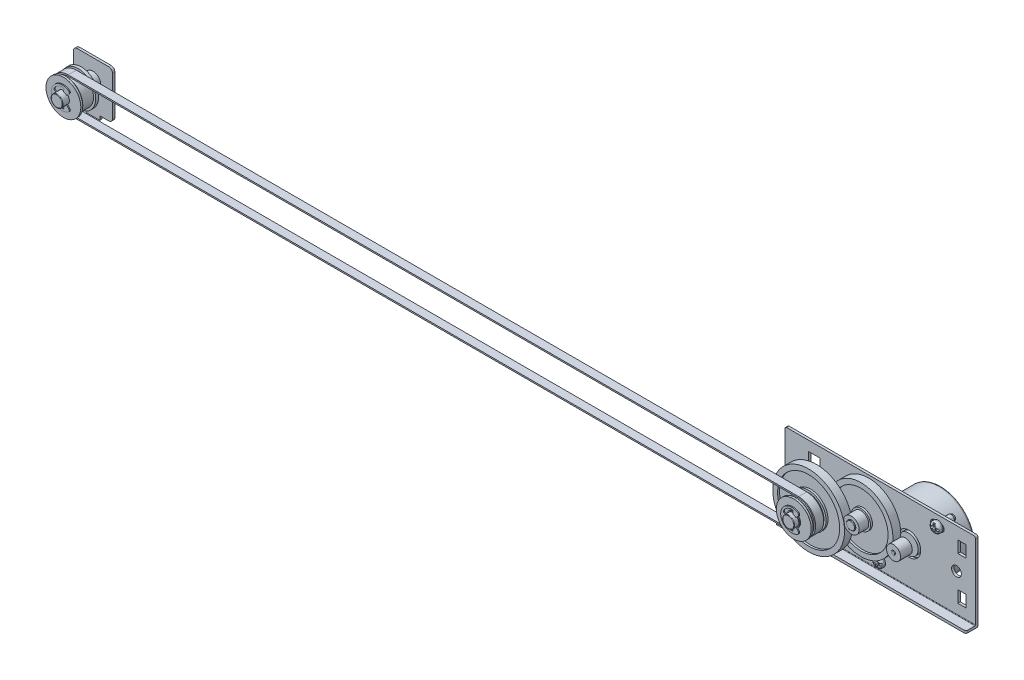
from build123d import *
from OCP.BRepFilletAPI import BRepFilletAPI_MakeChamfer

# Parameters (mm, degrees)
ESBO_O1_W                  = 97.4
ESBO_O1_H                  = 1.25
RESSALTO_EXTRUS_O1_DEPTH   = 6.2
ESBO_O2_W                  = 97.4
ESBO_O2_H                  = 1.25
RESSALTO_EXTRUS_O2_DEPTH   = 40.6
FILETE1_R                  = 1
ESBO_O3_R                  = 2
ESBO_O3_R_2                = 2.5
ESBO_O3_R_3                = 6
ESBO_O3_W                  = 4
ESBO_O3_H                  = 6
ESBO_O3_W_2                = 6
ESBO_O3_H_2                = 8
CORTE_EXTRUS_O1_DEPTH      = 40.6
ESBO_O6_R                  = 3
RESSALTO_EXTRUS_O3_DEPTH   = 22.5
ESBO_O7_R                  = 2.25
RESSALTO_EXTRUS_O4_DEPTH   = 12.3
FILETE2_R                  = 0.25
ESBO_O12_R                 = 4
RESSALTO_EXTRUS_O7_DEPTH   = 3
ESBO_O13_R                 = 4.5
RESSALTO_EXTRUS_O8_DEPTH   = 8.1
ESBO_O8_R                  = 16.365
ESBO_O8_R_2                = 2.3
RESSALTO_EXTRUS_O5_DEPTH   = 4
ESBO_O9_R                  = 4
ESBO_O9_R_2                = 2.3
RESSALTO_EXTRUS_O6_DEPTH   = 8.9
ESBO_O10_R                 = 13.865
ESBO_O10_R_2               = 4.9
CORTE_EXTRUS_O2_DEPTH      = 1
CORTE_EXTRUS_O3_START      = -1
ESBO_O11_R                 = 13.86
ESBO_O11_R_2               = 4.9
CORTE_EXTRUS_O3_DEPTH      = 1
ESBO_O14_R                 = 18.34
ESBO_O14_R_2               = 3.1
RESSALTO_EXTRUS_O9_DEPTH   = 4
ESBO_O15_R                 = 7.8
ESBO_O15_R_2               = 3.1
RESSALTO_EXTRUS_O10_DEPTH  = 11.6
RESSALTO_EXTRUS_O11_START  = -1.5
ESBO_O16_R                 = 8.9
ESBO_O16_R_2               = 3.1
RESSALTO_EXTRUS_O11_DEPTH  = 1.5
CHANFRO1_SIZE              = 0.5
ESBO_O17_R                 = 3.5
ESBO_O17_R_2               = 3.1
RESSALTO_EXTRUS_O12_DEPTH  = 0.5
CORTE_EXTRUS_O4_START      = -1
ESBO_O18_R                 = 15.84
ESBO_O18_R_2               = 8.9
CORTE_EXTRUS_O4_DEPTH      = 1
ESBO_O19_R                 = 15.825
ESBO_O19_R_2               = 8.9
CORTE_EXTRUS_O5_DEPTH      = 1
RESSALTO_EXTRUS_O13_DEPTH  = 0.5
ESBO_O21_R                 = 1.75
RESSALTO_EXTRUS_O14_DEPTH  = 0.92
ESBO_O23_R                 = 17.675026778
RESSALTO_EXTRUS_O15_DEPTH  = 15
FILETE4_R                  = 1
ESBO_O24_R                 = 2.05
ESBO_O24_R_2               = 1.75
RESSALTO_EXTRUS_O16_DEPTH  = 1
ESBO_O25_R                 = 2.5
RESSALTO_EXTRUS_O17_DEPTH  = 0.1
ESBO_O26_R                 = 1
RESSALTO_EXTRUS_O18_DEPTH  = 0.5
FILETE6_R                  = 0.1
ESBO_O27_R                 = 4.99
RESSALTO_EXTRUS_O19_DEPTH  = 16.57
RESSALTO_EXTRUS_O20_START  = -25
ESBO_O28_R                 = 1
RESSALTO_EXTRUS_O20_DEPTH  = 25
FILETE5_R                  = 0.25
ESBO_O29_R                 = 3.59
RESSALTO_EXTRUS_O21_DEPTH  = 6
ESBO_O30_R                 = 2.7
RESSALTO_EXTRUS_O22_DEPTH  = 2
FILETE7_R                  = 1.4
CORTE_EXTRUS_O6_DEPTH      = 1.4
ESBO_O32_R                 = 1.75
RESSALTO_EXTRUS_O23_DEPTH  = 7.8
CHANFRO2_SIZE              = 1
CHANFRO2_SIZE2             = 0.466307658
RESSALTO_EXTRUS_O24_DEPTH  = 10
ESBO_O34_R                 = 2
RESSALTO_EXTRUS_O25_DEPTH  = 5
ESBO_O35_R                 = 7.8
RESSALTO_EXTRUS_O26_DEPTH  = 7.6
ESBO_O37_R                 = 8.9
RESSALTO_EXTRUS_O27_DEPTH  = 1.5
CHANFRO3_SIZE              = 0.5
ESBO_O38_R                 = 8.9
RESSALTO_EXTRUS_O28_DEPTH  = 1.5
CORTE_EXTRUS_O7_DEPTH      = 16
CORTE_EXTRUS_O7_DEPTH_BACK = 35.5
ESBO_O39_R                 = 3.05
ESBO_O40_R                 = 4
RESSALTO_EXTRUS_O29_DEPTH  = 6
ESBO_O41_R                 = 3
RESSALTO_EXTRUS_O30_DEPTH  = 18.5
FILETE8_R                  = 0.25
RESSALTO_EXTRUS_O31_DEPTH  = 0.5
RESSALTO_EXTRUS_O32_DEPTH  = 1.2
FILETE9_R                  = 2
FILETE10_R                 = 0.3
RESSALTO_EXTRUS_O33_DEPTH  = 4.15
FILETE11_R                 = 0.5
FILETE12_R                 = 0.25


with BuildPart() as part:
    # Esboço1 → Ressalto-extrusão1 (new body)
    with BuildSketch(Plane.XY):
        Rectangle(ESBO_O1_W, ESBO_O1_H)
    extrude(amount=RESSALTO_EXTRUS_O1_DEPTH)

    # Esboço2 → Ressalto-extrusão2 (add)
    with BuildSketch(Plane(origin=(0, -0.625, 0), x_dir=(1, 0, 0), z_dir=(0, 1, 0))):
        with Locations((0, -0.625)):
            Rectangle(ESBO_O2_W, ESBO_O2_H)
    extrude(amount=RESSALTO_EXTRUS_O2_DEPTH)

    # Filete1
    filete1_edges = [part.edges().sort_by_distance(p)[0] for p in [
        (48.7, 0, 6.2),
        (48.7, 39.975, 0.625),
        (-48.7, 39.975, 0.625),
        (-48.7, 0, 6.2),
    ]]
    fillet(filete1_edges, radius=FILETE1_R)

    # Esboço3 → Corte-extrusão1 (cut)
    with BuildSketch(Plane.XY.offset(1.25)):
        with Locations((-43.7, 4.975)):
            Circle(ESBO_O3_R)
        with Locations((0, 4.975)):
            Circle(ESBO_O3_R)
        with Locations((38.95, 19.8)):
            Circle(ESBO_O3_R_2)
        with Locations((14.7, 19.8)):
            Circle(ESBO_O3_R_3)
        with Locations((41.7, 30.975)):
            Rectangle(ESBO_O3_W, ESBO_O3_H)
        with Locations((41.7, 8.975)):
            Rectangle(ESBO_O3_W, ESBO_O3_H)
        with Locations((-33.7, 8.975)):
            Rectangle(ESBO_O3_W_2, ESBO_O3_H_2)
        with BuildLine():
            Line((27.7, 36.975), (30.7, 36.975))
            ThreePointArc((30.7, 36.975), (32.7, 34.975), (30.7, 32.975))
            Line((30.7, 32.975), (27.7, 32.975))
            ThreePointArc((27.7, 32.975), (25.7, 34.975), (27.7, 36.975))
        make_face()
        with Locations((-33.7, 30.975)):
            Rectangle(ESBO_O3_W_2, ESBO_O3_H_2)
    extrude(amount=-CORTE_EXTRUS_O1_DEPTH, mode=Mode.SUBTRACT)

    # Esboço6 → Ressalto-extrusão3 (add)
    with BuildSketch(Plane(origin=(0, 0, 0), x_dir=(-1, 0, 0), z_dir=(0, 0, -1))):
        with Locations((25.7, 19.8)):
            Circle(ESBO_O6_R)
    extrude(amount=-RESSALTO_EXTRUS_O3_DEPTH)

    # Esboço7 → Ressalto-extrusão4 (add)
    with BuildSketch(Plane(origin=(0, 0, 0), x_dir=(-1, 0, 0), z_dir=(0, 0, -1))):
        with Locations((4.1, 23.975)):
            Circle(ESBO_O7_R)
    extrude(amount=-RESSALTO_EXTRUS_O4_DEPTH)

    # Filete2
    filete2_edges = [part.edges().sort_by_distance(p)[0] for p in [
        (-22.7, 19.8, 22.5),
        (-1.85, 23.975, 12.3),
    ]]
    fillet(filete2_edges, radius=FILETE2_R)

    # Esboço12 → Ressalto-extrusão7 (add)
    with BuildSketch(Plane.XY):
        with Locations(Location((-4.1, 23.975, 0), (0, 0, 180))):
            Circle(ESBO_O12_R)
    extrude(amount=RESSALTO_EXTRUS_O7_DEPTH)

    # Esboço13 → Ressalto-extrusão8 (add)
    with BuildSketch(Plane(origin=(0, 0, 0), x_dir=(-1, 0, 0), z_dir=(0, 0, -1))):
        with Locations((25.7, 19.8)):
            Circle(ESBO_O13_R)
    extrude(amount=-RESSALTO_EXTRUS_O8_DEPTH)

    # Esboço8 → Ressalto-extrusão5 (add)
    with BuildSketch(Plane.XY.offset(3)):
        with Locations((-4.1, 23.975)):
            Circle(ESBO_O8_R)
        with Locations((-4.1, 23.975)):
            Circle(ESBO_O8_R_2, mode=Mode.SUBTRACT)
    extrude(amount=RESSALTO_EXTRUS_O5_DEPTH)

    # Esboço9 → Ressalto-extrusão6 (add)
    with BuildSketch(Plane.XY.offset(3)):
        with Locations(Location((-4.1, 23.975, 0), (0, 0, 180))):
            Circle(ESBO_O9_R)
        with Locations((-4.1, 23.975)):
            Circle(ESBO_O9_R_2, mode=Mode.SUBTRACT)
    extrude(amount=RESSALTO_EXTRUS_O6_DEPTH)

    # Esboço10 → Corte-extrusão2 (cut)
    with BuildSketch(Plane.XY.offset(7)):
        with Locations((-4.1, 23.975)):
            Circle(ESBO_O10_R)
        with Locations((-4.1, 23.975)):
            Circle(ESBO_O10_R_2, mode=Mode.SUBTRACT)
    extrude(amount=-CORTE_EXTRUS_O2_DEPTH, mode=Mode.SUBTRACT)

    # Esboço11 → Corte-extrusão3 (cut)
    with BuildSketch(Plane(origin=(0, 0, 3), x_dir=(-1, 0, 0), z_dir=(0, 0, -1)).offset(CORTE_EXTRUS_O3_START)):
        with Locations((4.1, 23.975)):
            Circle(ESBO_O11_R)
        with Locations(Location((4.1, 23.975, 0), (0, 0, 180))):
            Circle(ESBO_O11_R_2, mode=Mode.SUBTRACT)
    extrude(amount=CORTE_EXTRUS_O3_DEPTH, mode=Mode.SUBTRACT)

    # Esboço14 → Ressalto-extrusão9 (add)
    with BuildSketch(Plane.XY.offset(8.1)):
        with Locations(Location((-25.7, 19.8, 0), (0, 0, 15.545528491))):
            Circle(ESBO_O14_R)
        with Locations((-25.7, 19.8)):
            Circle(ESBO_O14_R_2, mode=Mode.SUBTRACT)
    extrude(amount=RESSALTO_EXTRUS_O9_DEPTH)

    # Esboço15 → Ressalto-extrusão10 (add)
    with BuildSketch(Plane.XY.offset(8.1)):
        with Locations((-25.7, 19.8)):
            Circle(ESBO_O15_R)
        with Locations((-25.7, 19.8)):
            Circle(ESBO_O15_R_2, mode=Mode.SUBTRACT)
    extrude(amount=RESSALTO_EXTRUS_O10_DEPTH)

    # Esboço16 → Ressalto-extrusão11 (add)
    with BuildSketch(Plane.XY.offset(19.7).offset(RESSALTO_EXTRUS_O11_START)):
        with Locations((-25.7, 19.8)):
            Circle(ESBO_O16_R)
        with Locations((-25.7, 19.8)):
            Circle(ESBO_O16_R_2, mode=Mode.SUBTRACT)
    extrude(amount=RESSALTO_EXTRUS_O11_DEPTH)

    # Chanfro1
    chanfro1_edges = [part.edges().sort_by_distance(p)[0] for p in [
        (-34.6, 19.8, 18.2),
    ]]
    chamfer(chanfro1_edges, length=CHANFRO1_SIZE)

    # Esboço17 → Ressalto-extrusão12 (add)
    with BuildSketch(Plane.XY.offset(19.7)):
        with Locations((-25.7, 19.8)):
            Circle(ESBO_O17_R)
        with Locations((-25.7, 19.8)):
            Circle(ESBO_O17_R_2, mode=Mode.SUBTRACT)
    extrude(amount=RESSALTO_EXTRUS_O12_DEPTH)

    # Esboço18 → Corte-extrusão4 (cut)
    with BuildSketch(Plane.XY.offset(12.1).offset(CORTE_EXTRUS_O4_START)):
        with Locations((-25.7, 19.8)):
            Circle(ESBO_O18_R)
        with Locations((-25.7, 19.8)):
            Circle(ESBO_O18_R_2, mode=Mode.SUBTRACT)
    extrude(amount=CORTE_EXTRUS_O4_DEPTH, mode=Mode.SUBTRACT)

    # Esboço19 → Corte-extrusão5 (cut)
    with BuildSketch(Plane(origin=(0, 0, 8.1), x_dir=(-1, 0, 0), z_dir=(0, 0, -1))):
        with Locations((25.7, 19.8)):
            Circle(ESBO_O19_R)
        with Locations(Location((25.7, 19.8, 0), (0, 0, 180))):
            Circle(ESBO_O19_R_2, mode=Mode.SUBTRACT)
    extrude(amount=-CORTE_EXTRUS_O5_DEPTH, mode=Mode.SUBTRACT)

    # Esboço20 → Ressalto-extrusão13 (add)
    with BuildSketch(Plane.XY.offset(20.2)):
        with BuildLine():
            Line((-28.322721615, 20.626940949), (-29.67498238, 21.05330713))
            ThreePointArc((-29.67498238, 21.05330713), (-29.981119219, 21.326162864), (-29.980184512, 21.736247175))
            ThreePointArc((-29.980184512, 21.736247175), (-28.137076875, 23.816178393), (-25.441102958, 24.490629478))
            ThreePointArc((-25.441102958, 24.490629478), (-25.076922131, 24.302102712), (-24.9762544, 23.904565262))
            Line((-24.9762544, 23.904565262), (-25.222467511, 22.508221321))
            ThreePointArc((-25.222467511, 22.508221321), (-24.430191314, 22.239279791), (-23.755456352, 21.744543648))
            Line((-23.755456352, 21.744543648), (-22.474650348, 23.025349652))
            ThreePointArc((-22.474650348, 23.025349652), (-22.187573749, 23.840156974), (-22.642480013, 24.574584803))
            ThreePointArc((-22.642480013, 24.574584803), (-31.36966388, 19.8), (-22.642480013, 15.025415197))
            ThreePointArc((-22.642480013, 15.025415197), (-22.187573749, 15.759843026), (-22.474650348, 16.574650348))
            Line((-22.474650348, 16.574650348), (-23.755456352, 17.855456352))
            ThreePointArc((-23.755456352, 17.855456352), (-24.430191314, 17.360720209), (-25.222467511, 17.091778679))
            Line((-25.222467511, 17.091778679), (-24.9762544, 15.695434738))
            ThreePointArc((-24.9762544, 15.695434738), (-25.076922131, 15.297897288), (-25.441102958, 15.109370522))
            ThreePointArc((-25.441102958, 15.109370522), (-28.137076875, 15.783821607), (-29.980184512, 17.863752825))
            ThreePointArc((-29.980184512, 17.863752825), (-29.981119219, 18.273837136), (-29.67498238, 18.54669287))
            Line((-29.67498238, 18.54669287), (-28.322721615, 18.973059051))
            ThreePointArc((-28.322721615, 18.973059051), (-28.45, 19.8), (-28.322721615, 20.626940949))
        make_face()
    extrude(amount=RESSALTO_EXTRUS_O13_DEPTH)

    # Esboço21 → Ressalto-extrusão14 (add)
    with BuildSketch(Plane(origin=(0, 0, 0), x_dir=(-1, 0, 0), z_dir=(0, 0, -1))):
        with BuildLine():
            Line((3.595164465, 5.161527392), (2.779555471, 20.88173038))
            ThreePointArc((2.779555471, 20.88173038), (-2.196938457, 32.222448714), (-13.433733778, 37.429349428))
            Line((-13.433733778, 37.429349428), (-29.134017665, 38.565609025))
            ThreePointArc((-29.134017665, 38.565609025), (-31.845866586, 37.610857858), (-32.993876913, 34.975))
            Line((-32.993876913, 34.975), (-32.993876913, 30.076020514))
            Line((-32.993876913, 30.076020514), (-30.487753652, 27.518219171))
            ThreePointArc((-30.487753652, 27.518219171), (-27.196938457, 7.727551286), (-7.477551833, 4.033530282))
            Line((-7.477551833, 4.033530282), (-4.87273477, 1.375))
            Line((-4.87273477, 1.375), (0, 1.375))
            ThreePointArc((0, 1.375), (2.610699007, 2.49624009), (3.595164465, 5.161527392))
        make_face()
        with Locations((0, 4.975)):
            Circle(ESBO_O21_R, mode=Mode.SUBTRACT)
        with Locations((-29.393876913, 34.975)):
            Circle(ESBO_O21_R, mode=Mode.SUBTRACT)
    extrude(amount=RESSALTO_EXTRUS_O14_DEPTH)

    # Esboço23 → Ressalto-extrusão15 (add)
    with BuildSketch(Plane.XY):
        with Locations((14.7, 19.8)):
            Circle(ESBO_O23_R)
    extrude(amount=-RESSALTO_EXTRUS_O15_DEPTH)

    # Filete4
    filete4_edges = [part.edges().sort_by_distance(p)[0] for p in [
        (-2.975026778, 19.8, -15),
    ]]
    fillet(filete4_edges, radius=FILETE4_R)

    # Esboço24 → Ressalto-extrusão16 (add)
    # profile 1 of 2: a face of its own
    with BuildSketch(Plane(origin=(0, 0, -0.92), x_dir=(-1, 0, 0), z_dir=(0, 0, -1))):
        with Locations((0, 4.975)):
            Circle(ESBO_O24_R)
        with Locations((0, 4.975)):
            Circle(ESBO_O24_R_2, mode=Mode.SUBTRACT)
    # profile 2 of 2: a face of its own
    with BuildSketch(Plane(origin=(0, 0, -0.92), x_dir=(-1, 0, 0), z_dir=(0, 0, -1))):
        with Locations((-29.393876913, 34.975)):
            Circle(ESBO_O24_R)
        with Locations((-29.393876913, 34.975)):
            Circle(ESBO_O24_R_2, mode=Mode.SUBTRACT)
    extrude(amount=RESSALTO_EXTRUS_O16_DEPTH)

    # Esboço25 → Ressalto-extrusão17 (add)
    with BuildSketch(Plane(origin=(0, 0, -15), x_dir=(-1, 0, 0), z_dir=(0, 0, -1))):
        with Locations(Location((-14.7, 19.8, 0), (0, 0, 180))):
            Circle(ESBO_O25_R)
    extrude(amount=RESSALTO_EXTRUS_O17_DEPTH)

    # Esboço26 → Ressalto-extrusão18 (add)
    with BuildSketch(Plane(origin=(0, 0, -15.1), x_dir=(-1, 0, 0), z_dir=(0, 0, -1))):
        with Locations((-14.7, 19.8)):
            Circle(ESBO_O26_R)
    extrude(amount=RESSALTO_EXTRUS_O18_DEPTH)

    # Filete6
    filete6_edges = [part.edges().sort_by_distance(p)[0] for p in [
        (12.2, 19.8, -15.1),
    ]]
    fillet(filete6_edges, radius=FILETE6_R - 0.0001)  # a hair under: the kernel refuses the full size

    # Esboço27 → Ressalto-extrusão19 (add)
    with BuildSketch(Plane.XY.offset(-15)):
        with Locations(Location((14.7, 19.8, 0), (0, 0, 180))):
            Circle(ESBO_O27_R)
    extrude(amount=RESSALTO_EXTRUS_O19_DEPTH)

    # Esboço28 → Ressalto-extrusão20 (add)
    with BuildSketch(Plane(origin=(0, 0, -15.6), x_dir=(-1, 0, 0), z_dir=(0, 0, -1)).offset(RESSALTO_EXTRUS_O20_START)):
        with Locations((-14.7, 19.8)):
            Circle(ESBO_O28_R)
    extrude(amount=RESSALTO_EXTRUS_O20_DEPTH)

    # Filete5
    filete5_edges = [part.edges().sort_by_distance(p)[0] for p in [
        (15.7, 19.8, -15.6),
        (15.7, 19.8, 9.4),
    ]]
    fillet(filete5_edges, radius=FILETE5_R)

    # Esboço29 → Ressalto-extrusão21 (add)
    with BuildSketch(Plane.XY.offset(9.15)):
        with Locations((14.7, 19.8)):
            Circle(ESBO_O29_R)
    extrude(amount=-RESSALTO_EXTRUS_O21_DEPTH)

    # Esboço30 → Ressalto-extrusão22 (add)
    with BuildSketch(Plane.XY.offset(1.25)):
        with Locations(Location((0, 4.975, 0), (0, 0, 180))):
            Circle(ESBO_O30_R)
        with Locations(Location((29.393876913, 34.975, 0), (0, 0, 227.672748848))):
            Circle(ESBO_O30_R)
    extrude(amount=RESSALTO_EXTRUS_O22_DEPTH)

    # Filete7
    filete7_edges = [part.edges().sort_by_distance(p)[0] for p in [
        (2.7, 4.975, 3.25),
        (31.211960314, 36.971139461, 3.25),
    ]]
    fillet(filete7_edges, radius=FILETE7_R)

    # Esboço31 → Corte-extrusão6 (cut)
    with BuildSketch(Plane.XY.offset(3.25)):
        with BuildLine():
            Line((29.093876913, 37.175), (29.693876913, 37.175))
            ThreePointArc((29.693876913, 37.175), (29.83529827, 37.116421356), (29.893876913, 36.975))
            Line((29.893876913, 36.975), (29.893876913, 35.975))
            ThreePointArc((29.893876913, 35.975), (30.040323523, 35.621446609), (30.393876913, 35.475))
            Line((30.393876913, 35.475), (31.393876913, 35.475))
            ThreePointArc((31.393876913, 35.475), (31.53529827, 35.416421356), (31.593876913, 35.275))
            Line((31.593876913, 35.275), (31.593876913, 34.675))
            ThreePointArc((31.593876913, 34.675), (31.53529827, 34.533578644), (31.393876913, 34.475))
            Line((31.393876913, 34.475), (30.393876913, 34.475))
            ThreePointArc((30.393876913, 34.475), (30.040323523, 34.328553391), (29.893876913, 33.975))
            Line((29.893876913, 33.975), (29.893876913, 32.975))
            ThreePointArc((29.893876913, 32.975), (29.83529827, 32.833578644), (29.693876913, 32.775))
            Line((29.693876913, 32.775), (29.093876913, 32.775))
            ThreePointArc((29.093876913, 32.775), (28.952455557, 32.833578644), (28.893876913, 32.975))
            Line((28.893876913, 32.975), (28.893876913, 33.975))
            ThreePointArc((28.893876913, 33.975), (28.747430304, 34.328553391), (28.393876913, 34.475))
            Line((28.393876913, 34.475), (27.393876913, 34.475))
            ThreePointArc((27.393876913, 34.475), (27.252455557, 34.533578644), (27.193876913, 34.675))
            Line((27.193876913, 34.675), (27.193876913, 35.275))
            ThreePointArc((27.193876913, 35.275), (27.252455557, 35.416421356), (27.393876913, 35.475))
            Line((27.393876913, 35.475), (28.393876913, 35.475))
            ThreePointArc((28.393876913, 35.475), (28.747430304, 35.621446609), (28.893876913, 35.975))
            Line((28.893876913, 35.975), (28.893876913, 36.975))
            ThreePointArc((28.893876913, 36.975), (28.952455557, 37.116421356), (29.093876913, 37.175))
        make_face()
        with BuildLine():
            Line((-0.142061447, 7.325028719), (0.457938553, 7.325028719))
            ThreePointArc((0.457938553, 7.325028719), (0.59935991, 7.266450075), (0.657938553, 7.125028719))
            Line((0.657938553, 7.125028719), (0.657938553, 6.125028719))
            ThreePointArc((0.657938553, 6.125028719), (0.804385163, 5.771475328), (1.157938553, 5.625028719))
            Line((1.157938553, 5.625028719), (2.157938553, 5.625028719))
            ThreePointArc((2.157938553, 5.625028719), (2.29935991, 5.566450075), (2.357938553, 5.425028719))
            Line((2.357938553, 5.425028719), (2.357938553, 4.825028719))
            ThreePointArc((2.357938553, 4.825028719), (2.29935991, 4.683607363), (2.157938553, 4.625028719))
            Line((2.157938553, 4.625028719), (1.157938553, 4.625028719))
            ThreePointArc((1.157938553, 4.625028719), (0.804385163, 4.478582109), (0.657938553, 4.125028719))
            Line((0.657938553, 4.125028719), (0.657938553, 3.125028719))
            ThreePointArc((0.657938553, 3.125028719), (0.59935991, 2.983607363), (0.457938553, 2.925028719))
            Line((0.457938553, 2.925028719), (-0.142061447, 2.925028719))
            ThreePointArc((-0.142061447, 2.925028719), (-0.283482803, 2.983607363), (-0.342061447, 3.125028719))
            Line((-0.342061447, 3.125028719), (-0.342061447, 4.125028719))
            ThreePointArc((-0.342061447, 4.125028719), (-0.488508056, 4.478582109), (-0.842061447, 4.625028719))
            Line((-0.842061447, 4.625028719), (-1.842061447, 4.625028719))
            ThreePointArc((-1.842061447, 4.625028719), (-1.983482803, 4.683607363), (-2.042061447, 4.825028719))
            Line((-2.042061447, 4.825028719), (-2.042061447, 5.425028719))
            ThreePointArc((-2.042061447, 5.425028719), (-1.983482803, 5.566450075), (-1.842061447, 5.625028719))
            Line((-1.842061447, 5.625028719), (-0.842061447, 5.625028719))
            ThreePointArc((-0.842061447, 5.625028719), (-0.488508056, 5.771475328), (-0.342061447, 6.125028719))
            Line((-0.342061447, 6.125028719), (-0.342061447, 7.125028719))
            ThreePointArc((-0.342061447, 7.125028719), (-0.283482803, 7.266450075), (-0.142061447, 7.325028719))
        make_face()
    extrude(amount=-CORTE_EXTRUS_O6_DEPTH, mode=Mode.SUBTRACT)

    # Esboço32 → Ressalto-extrusão23 (add)
    with BuildSketch(Plane(origin=(0, 0, 1.25), x_dir=(-1, 0, 0), z_dir=(0, 0, -1))):
        with Locations((0, 4.975)):
            Circle(ESBO_O32_R)
        with Locations(Location((-29.393876913, 34.975, 0), (0, 0, 180))):
            Circle(ESBO_O32_R)
    extrude(amount=RESSALTO_EXTRUS_O23_DEPTH)

    # Chanfro2: one chamfer whose edges measure the first distance from different faces: ONE call of the kernel's chamfer builder (chamfer() names one face for all edges)
    chanfro2_edges_1 = [part.edges().sort_by_distance(p)[0] for p in [
        (1.75, 4.975, -6.55),
    ]]
    chanfro2_side_1 = [part.faces().sort_by_distance(p)[0] for p in [
        (1.75, 4.975, -4.235),
    ]]
    chanfro2_edges_2 = [part.edges().sort_by_distance(p)[0] for p in [
        (27.643876913, 34.975, -6.55),
    ]]
    chanfro2_side_2 = [part.faces().sort_by_distance(p)[0] for p in [
        (27.643876913, 34.975, -4.235),
    ]]
    chanfro2 = BRepFilletAPI_MakeChamfer(part.part.solid().wrapped)
    for e in chanfro2_edges_1:
        chanfro2.Add(CHANFRO2_SIZE, CHANFRO2_SIZE2, e.wrapped, chanfro2_side_1[0].wrapped)  # the first distance lies on this face
    for e in chanfro2_edges_2:
        chanfro2.Add(CHANFRO2_SIZE, CHANFRO2_SIZE2, e.wrapped, chanfro2_side_2[0].wrapped)  # the first distance lies on this face
    add(Compound.cast(chanfro2.Shape()), mode=Mode.REPLACE)

    # Esboço33 → Ressalto-extrusão24 (add)
    with BuildSketch(Plane(origin=(0, 0, -0.92), x_dir=(-1, 0, 0), z_dir=(0, 0, -1))):
        with BuildLine():
            Line((3.196311276, 12.849099671), (3.224269109, 12.846096875))
            Line((3.224269109, 12.846096875), (4.292171901, 22.788912554))
            Line((4.292171901, 22.788912554), (2.690076099, 22.960984796))
            ThreePointArc((2.690076099, 22.960984796), (2.95476648, 20.646044994), (2.912651997, 18.316402606))
            Line((2.912651997, 18.316402606), (3.196311276, 12.849099671))
        make_face()
        with BuildLine():
            Line((1.622173307, 13.018169117), (3.196311276, 12.849099671))
            Line((3.196311276, 12.849099671), (2.912651997, 18.316402606))
            ThreePointArc((2.912651997, 18.316402606), (2.472970379, 15.617218633), (1.622173307, 13.018169117))
        make_face()
    extrude(amount=RESSALTO_EXTRUS_O24_DEPTH)

    # Esboço34 → Ressalto-extrusão25 (add)
    with BuildSketch(Plane(origin=(-1.823505509, -0.195852632, 0), x_dir=(0, 0, 1), z_dir=(-0.9942815679049348, -0.10679027916671441, 0))):
        with Locations(Location((-5.92, 18.116957941, 0), (0, 0, 270))):
            Circle(ESBO_O34_R)
    extrude(amount=RESSALTO_EXTRUS_O25_DEPTH)

    # Filete11
    filete11_edges = [part.edges().sort_by_distance(p)[0] for p in [
        (0, -0.625, 0),
    ]]
    fillet(filete11_edges, radius=FILETE11_R)

    # Filete12
    filete12_edges = [part.edges().sort_by_distance(p)[0] for p in [
        (0, 0.625, 1.25),
    ]]
    fillet(filete12_edges, radius=FILETE12_R)


with BuildPart() as body_2:
    # Esboço35 → Ressalto-extrusão26 (new body)
    with BuildSketch(Plane.XY.offset(12.1)):
        with Locations(Location((-398.7, 19.8, 0), (0, 0, 180))):
            Circle(ESBO_O35_R)
    extrude(amount=RESSALTO_EXTRUS_O26_DEPTH)

    # Esboço37 → Ressalto-extrusão27 (add)
    with BuildSketch(Plane.XY.offset(19.7)):
        with Locations((-398.7, 19.8)):
            Circle(ESBO_O37_R)
    extrude(amount=-RESSALTO_EXTRUS_O27_DEPTH)

    # Chanfro3
    chanfro3_edges = [body_2.edges().sort_by_distance(p)[0] for p in [
        (-407.6, 19.8, 18.2),
    ]]
    chamfer(chanfro3_edges, length=CHANFRO3_SIZE)

    # Esboço38 → Ressalto-extrusão28 (add)
    with BuildSketch(Plane(origin=(0, 0, 12.1), x_dir=(-1, 0, 0), z_dir=(0, 0, -1))):
        with Locations(Location((398.7, 19.8, 0), (0, 0, 180))):
            Circle(ESBO_O38_R)
    extrude(amount=RESSALTO_EXTRUS_O28_DEPTH)

    # Esboço39 → Corte-extrusão7 (cut, two sides: drawn at the far end of the back side and taken through both)
    with BuildSketch(Plane.XY.offset(19.7).offset(-CORTE_EXTRUS_O7_DEPTH_BACK)):
        with Locations(Location((-398.7, 19.8, 0), (0, 0, 180))):
            Circle(ESBO_O39_R)
    extrude(amount=CORTE_EXTRUS_O7_DEPTH + CORTE_EXTRUS_O7_DEPTH_BACK, mode=Mode.SUBTRACT)

    # Esboço40 → Ressalto-extrusão29 (add)
    with BuildSketch(Plane(origin=(0, 0, 10.6), x_dir=(-1, 0, 0), z_dir=(0, 0, -1))):
        with Locations((398.7, 19.8)):
            Circle(ESBO_O40_R)
    extrude(amount=RESSALTO_EXTRUS_O29_DEPTH)

    # Esboço41 → Ressalto-extrusão30 (add)
    with BuildSketch(Plane(origin=(0, 0, 4.6), x_dir=(-1, 0, 0), z_dir=(0, 0, -1))):
        with Locations((398.7, 19.8)):
            Circle(ESBO_O41_R)
    extrude(amount=-RESSALTO_EXTRUS_O30_DEPTH)

    # Filete8
    filete8_edges = [body_2.edges().sort_by_distance(p)[0] for p in [
        (-395.7, 19.8, 23.1),
    ]]
    fillet(filete8_edges, radius=FILETE8_R)

    # Esboço42 → Ressalto-extrusão31 (add)
    with BuildSketch(Plane.XY.offset(19.7)):
        with BuildLine():
            Line((-401.322721615, 20.626940949), (-402.67498238, 21.05330713))
            ThreePointArc((-402.67498238, 21.05330713), (-402.981119219, 21.326162864), (-402.980184512, 21.736247175))
            ThreePointArc((-402.980184512, 21.736247175), (-401.137076875, 23.816178393), (-398.441102958, 24.490629478))
            ThreePointArc((-398.441102958, 24.490629478), (-398.076922131, 24.302102712), (-397.9762544, 23.904565262))
            Line((-397.9762544, 23.904565262), (-398.222467511, 22.508221321))
            ThreePointArc((-398.222467511, 22.508221321), (-397.430191314, 22.239279791), (-396.755456352, 21.744543648))
            Line((-396.755456352, 21.744543648), (-395.474650348, 23.025349652))
            ThreePointArc((-395.474650348, 23.025349652), (-395.187573749, 23.840156974), (-395.642480013, 24.574584803))
            ThreePointArc((-395.642480013, 24.574584803), (-404.36966388, 19.8), (-395.642480013, 15.025415197))
            ThreePointArc((-395.642480013, 15.025415197), (-395.187573749, 15.759843026), (-395.474650348, 16.574650348))
            Line((-395.474650348, 16.574650348), (-396.755456352, 17.855456352))
            ThreePointArc((-396.755456352, 17.855456352), (-397.430191314, 17.360720209), (-398.222467511, 17.091778679))
            Line((-398.222467511, 17.091778679), (-397.9762544, 15.695434738))
            ThreePointArc((-397.9762544, 15.695434738), (-398.076922131, 15.297897288), (-398.441102958, 15.109370522))
            ThreePointArc((-398.441102958, 15.109370522), (-401.137076875, 15.783821607), (-402.980184512, 17.863752825))
            ThreePointArc((-402.980184512, 17.863752825), (-402.981119219, 18.273837136), (-402.67498238, 18.54669287))
            Line((-402.67498238, 18.54669287), (-401.322721615, 18.973059051))
            ThreePointArc((-401.322721615, 18.973059051), (-401.45, 19.8), (-401.322721615, 20.626940949))
        make_face()
    extrude(amount=RESSALTO_EXTRUS_O31_DEPTH)

    # Esboço43 → Ressalto-extrusão32 (add)
    with BuildSketch(Plane(origin=(0, 0, 4.6), x_dir=(-1, 0, 0), z_dir=(0, 0, -1))):
        Polygon((402.2, 5.8), (402.2, 3.8), (395.2, 3.8), (395.2, 5.8), (388.7, 5.8), (388.7, 29.8), (408.7, 29.8), (408.7, 5.8), align=None)
    extrude(amount=RESSALTO_EXTRUS_O32_DEPTH)

    # Filete9
    filete9_edges = [body_2.edges().sort_by_distance(p)[0] for p in [
        (-408.7, 5.8, 4),
        (-408.7, 29.8, 4),
        (-388.7, 29.8, 4),
        (-388.7, 5.8, 4),
    ]]
    fillet(filete9_edges, radius=FILETE9_R)

    # Filete10
    filete10_edges = [body_2.edges().sort_by_distance(p)[0] for p in [
        (-395.2, 5.8, 4),
        (-402.2, 5.8, 4),
    ]]
    fillet(filete10_edges, radius=FILETE10_R)


with BuildPart() as body_3:
    # Esboço44 → Ressalto-extrusão33 (new body)
    with BuildSketch(Plane.XY.offset(13.1)):
        with BuildLine():
            Line((-398.7, 28.5), (-25.7, 28.5))
            ThreePointArc((-25.7, 28.5), (-17, 19.8), (-25.7, 11.1))
            Line((-25.7, 11.1), (-398.7, 11.1))
            ThreePointArc((-398.7, 11.1), (-407.4, 19.8), (-398.7, 28.5))
        make_face()
        with BuildLine():
            Line((-398.7, 27.8), (-25.7, 27.8))
            ThreePointArc((-25.7, 27.8), (-17.7, 19.8), (-25.7, 11.8))
            Line((-25.7, 11.8), (-398.7, 11.8))
            ThreePointArc((-398.7, 11.8), (-406.7, 19.8), (-398.7, 27.8))
        make_face(mode=Mode.SUBTRACT)
    extrude(amount=RESSALTO_EXTRUS_O33_DEPTH)


solid = Compound([part.part, body_2.part, body_3.part])
